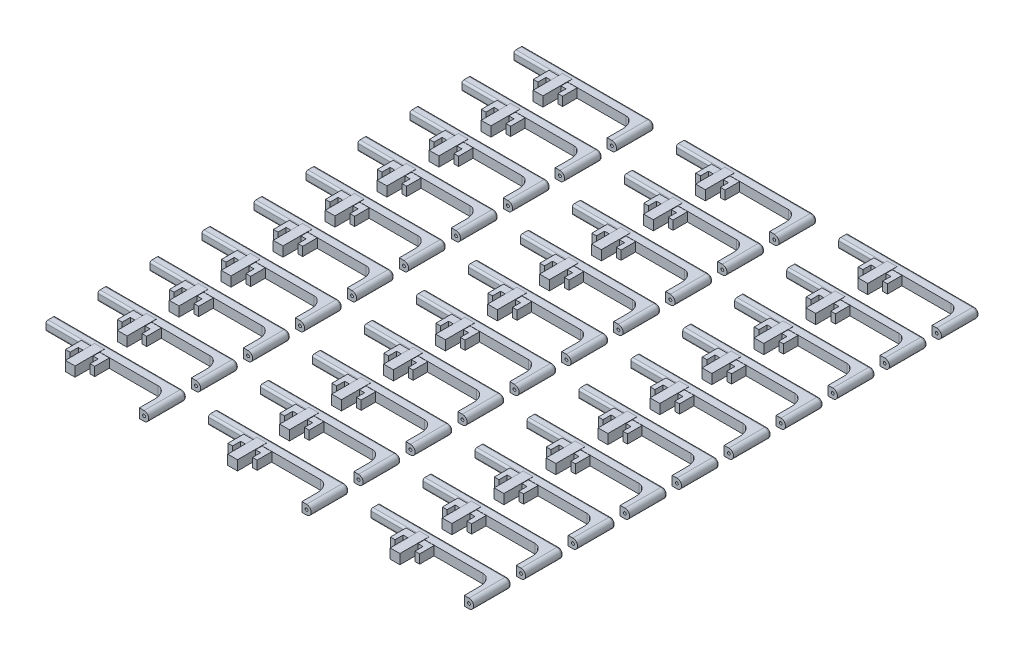
from build123d import *

# Parameters (mm, degrees)
SKETCH_1_W               = 2.4
SKETCH_1_H               = 2.4
EXTRUDE_1_DEPTH          = 7.2
EXTRUDE_2_DEPTH          = 18
EXTRUDE_2_DEPTH_BACK     = 12
SKETCH_4_W               = 2.3
SKETCH_4_H               = 2.3
EXTRUDE_3_DEPTH          = 7
EXTRUDE_3_DEPTH_BACK     = 2.3
SKETCH_5_R               = 0.35
SKETCH_6_R               = 0.35
CUT_EXTRUDE_1_DEPTH      = 10
FILLET_1_SIZE            = 2.4
FILLET_1_SIZE_2          = 3.2
FILLET_2_R               = 0.5
EXTRUDE_START            = -1.5
SKETCH_7_W               = 1.15
SKETCH_7_H               = 0.45
SKETCH_7_H_2             = 1.3
SKETCH_7_H_3             = 2.2
EXTRUDE_4_DEPTH          = 5.1
SKETCH_8_W               = 7.2
SKETCH_8_H               = 2.2
EXTRUDE_5_DEPTH          = 3.1
PATTERN_LINEAR_1_COUNT   = 10
PATTERN_LINEAR_1_PITCH   = 12.8
PATTERN_LINEAR_1_2_COUNT = 3
PATTERN_LINEAR_1_2_PITCH = 40


with BuildPart() as part:
    # 草图1 → 凸台-拉伸1 (new body)
    with BuildSketch(Plane.XY):
        Rectangle(SKETCH_1_W, SKETCH_1_H)
    extrude(amount=EXTRUDE_1_DEPTH)

    # 草图4 → 凸台-拉伸2 (add, two sides: drawn at the far end of the back side and taken through both)
    with BuildSketch(Plane(origin=(0, 0, 0), x_dir=(0, 0, -1), z_dir=(1, 0, 0)).offset(-EXTRUDE_2_DEPTH_BACK)):
        Rectangle(SKETCH_4_W, SKETCH_4_H)
    extrude(amount=EXTRUDE_2_DEPTH + EXTRUDE_2_DEPTH_BACK)

    # 草图5 → 凸台-拉伸3 (add, two sides: drawn at the far end of the back side and taken through both)
    with BuildSketch(Plane.XY.offset(1.15).offset(-EXTRUDE_3_DEPTH_BACK)):
        with BuildLine():
            Line((18, 0), (18, 1.15))
            Line((18, 1.15), (19.15, 1.15))
            ThreePointArc((19.15, 1.15), (20.3, 0), (19.15, -1.15))
            Line((19.15, -1.15), (18, -1.15))
            Line((18, -1.15), (18, 0))
        make_face()
        with Locations(Location((19.15, 0, 0), (0, 0, 180))):
            Circle(SKETCH_5_R, mode=Mode.SUBTRACT)
    extrude(amount=EXTRUDE_3_DEPTH + EXTRUDE_3_DEPTH_BACK)

    # 草图6 → 切除-拉伸1 (cut)
    with BuildSketch(Plane.ZY.offset(12)):
        Circle(SKETCH_6_R)
    extrude(amount=-CUT_EXTRUDE_1_DEPTH, mode=Mode.SUBTRACT)

    # 圆角1
    # an asymmetric fillet: 3.2, 2.4 mm, written as the material it adds along each edge
    with BuildSketch(Plane(origin=(18, 1.15, 1.15), x_dir=(-1, 0, 0), z_dir=(0, -1, 0))) as fillet_1_piece_1:
        with BuildLine():
            Bezier((FILLET_1_SIZE, 0), (0, 0), (0, -FILLET_1_SIZE_2), weights=[1, 0.707106781, 1])
            Line((0, -FILLET_1_SIZE_2), (0, 0))
            Line((0, 0), (FILLET_1_SIZE, 0))
        make_face()
    extrude(amount=2.3)

    # 圆角2
    fillet_2_edges = [part.edges().sort_by_distance(p)[0] for p in [
        (-6.6, -1.15, 1.15),
        (3.575, -1.15, -1.15),
        (-6.6, 1.15, 1.15),
        (3.575, 1.15, -1.15),
        (20.3, 0, -1.15),
    ]]
    fillet(fillet_2_edges, radius=FILLET_2_R)

    # 草图7 → 凸台-拉伸4 (add)
    with BuildSketch(Plane.XY.offset(1.15).offset(EXTRUDE_START)):
        with Locations((-3.025, 0.875)):
            Rectangle(SKETCH_7_W, SKETCH_7_H)
        with Locations((-3.025, 0)):
            Rectangle(SKETCH_7_W, SKETCH_7_H_2)
        with Locations((-3.025, -0.875)):
            Rectangle(SKETCH_7_W, SKETCH_7_H)
        with Locations((3.025, 0)):
            Rectangle(SKETCH_7_W, SKETCH_7_H_3)
    extrude(amount=EXTRUDE_4_DEPTH)

    # 草图8 → 凸台-拉伸5 (add)
    with BuildSketch(Plane.XY.offset(1.15).offset(EXTRUDE_START)):
        Rectangle(SKETCH_8_W, SKETCH_8_H)
    extrude(amount=EXTRUDE_5_DEPTH)


with BuildPart() as pattern_linear_1_1:
    # 阵列(线性)1: pattern copy
    add(part.part.moved(Location(Vector(0, 0, 1) * (1 * PATTERN_LINEAR_1_PITCH))))


with BuildPart() as pattern_linear_1_2:
    # 阵列(线性)1: pattern copy
    add(part.part.moved(Location(Vector(0, 0, 1) * (2 * PATTERN_LINEAR_1_PITCH))))


with BuildPart() as pattern_linear_1_3:
    # 阵列(线性)1: pattern copy
    add(part.part.moved(Location(Vector(0, 0, 1) * (3 * PATTERN_LINEAR_1_PITCH))))


with BuildPart() as pattern_linear_1_4:
    # 阵列(线性)1: pattern copy
    add(part.part.moved(Location(Vector(0, 0, 1) * (4 * PATTERN_LINEAR_1_PITCH))))


with BuildPart() as pattern_linear_1_5:
    # 阵列(线性)1: pattern copy
    add(part.part.moved(Location(Vector(0, 0, 1) * (5 * PATTERN_LINEAR_1_PITCH))))


with BuildPart() as pattern_linear_1_6:
    # 阵列(线性)1: pattern copy
    add(part.part.moved(Location(Vector(0, 0, 1) * (6 * PATTERN_LINEAR_1_PITCH))))


with BuildPart() as pattern_linear_1_7:
    # 阵列(线性)1: pattern copy
    add(part.part.moved(Location(Vector(0, 0, 1) * (7 * PATTERN_LINEAR_1_PITCH))))


with BuildPart() as pattern_linear_1_8:
    # 阵列(线性)1: pattern copy
    add(part.part.moved(Location(Vector(0, 0, 1) * (8 * PATTERN_LINEAR_1_PITCH))))


with BuildPart() as pattern_linear_1_9:
    # 阵列(线性)1: pattern copy
    add(part.part.moved(Location(Vector(0, 0, 1) * (9 * PATTERN_LINEAR_1_PITCH))))


with BuildPart() as pattern_linear_1_2_1:
    # Pattern Linear 1 2: pattern copy
    add(part.part.moved(Location(Vector(1, 0, 0) * (1 * PATTERN_LINEAR_1_2_PITCH))))


with BuildPart() as pattern_linear_1_2_2:
    # Pattern Linear 1 2: pattern copy
    add(part.part.moved(Location(Vector(1, 0, 0) * (2 * PATTERN_LINEAR_1_2_PITCH))))


with BuildPart() as pattern_linear_1_2_3:
    # Pattern Linear 1 2: pattern copy
    add(pattern_linear_1_1.part.moved(Location(Vector(1, 0, 0) * (1 * PATTERN_LINEAR_1_2_PITCH))))


with BuildPart() as pattern_linear_1_2_4:
    # Pattern Linear 1 2: pattern copy
    add(pattern_linear_1_1.part.moved(Location(Vector(1, 0, 0) * (2 * PATTERN_LINEAR_1_2_PITCH))))


with BuildPart() as pattern_linear_1_2_5:
    # Pattern Linear 1 2: pattern copy
    add(pattern_linear_1_2.part.moved(Location(Vector(1, 0, 0) * (1 * PATTERN_LINEAR_1_2_PITCH))))


with BuildPart() as pattern_linear_1_2_6:
    # Pattern Linear 1 2: pattern copy
    add(pattern_linear_1_2.part.moved(Location(Vector(1, 0, 0) * (2 * PATTERN_LINEAR_1_2_PITCH))))


with BuildPart() as pattern_linear_1_2_7:
    # Pattern Linear 1 2: pattern copy
    add(pattern_linear_1_3.part.moved(Location(Vector(1, 0, 0) * (1 * PATTERN_LINEAR_1_2_PITCH))))


with BuildPart() as pattern_linear_1_2_8:
    # Pattern Linear 1 2: pattern copy
    add(pattern_linear_1_3.part.moved(Location(Vector(1, 0, 0) * (2 * PATTERN_LINEAR_1_2_PITCH))))


with BuildPart() as pattern_linear_1_2_9:
    # Pattern Linear 1 2: pattern copy
    add(pattern_linear_1_4.part.moved(Location(Vector(1, 0, 0) * (1 * PATTERN_LINEAR_1_2_PITCH))))


with BuildPart() as pattern_linear_1_2_10:
    # Pattern Linear 1 2: pattern copy
    add(pattern_linear_1_4.part.moved(Location(Vector(1, 0, 0) * (2 * PATTERN_LINEAR_1_2_PITCH))))


with BuildPart() as pattern_linear_1_2_11:
    # Pattern Linear 1 2: pattern copy
    add(pattern_linear_1_5.part.moved(Location(Vector(1, 0, 0) * (1 * PATTERN_LINEAR_1_2_PITCH))))


with BuildPart() as pattern_linear_1_2_12:
    # Pattern Linear 1 2: pattern copy
    add(pattern_linear_1_5.part.moved(Location(Vector(1, 0, 0) * (2 * PATTERN_LINEAR_1_2_PITCH))))


with BuildPart() as pattern_linear_1_2_13:
    # Pattern Linear 1 2: pattern copy
    add(pattern_linear_1_6.part.moved(Location(Vector(1, 0, 0) * (1 * PATTERN_LINEAR_1_2_PITCH))))


with BuildPart() as pattern_linear_1_2_14:
    # Pattern Linear 1 2: pattern copy
    add(pattern_linear_1_6.part.moved(Location(Vector(1, 0, 0) * (2 * PATTERN_LINEAR_1_2_PITCH))))


with BuildPart() as pattern_linear_1_2_15:
    # Pattern Linear 1 2: pattern copy
    add(pattern_linear_1_7.part.moved(Location(Vector(1, 0, 0) * (1 * PATTERN_LINEAR_1_2_PITCH))))


with BuildPart() as pattern_linear_1_2_16:
    # Pattern Linear 1 2: pattern copy
    add(pattern_linear_1_7.part.moved(Location(Vector(1, 0, 0) * (2 * PATTERN_LINEAR_1_2_PITCH))))


with BuildPart() as pattern_linear_1_2_17:
    # Pattern Linear 1 2: pattern copy
    add(pattern_linear_1_8.part.moved(Location(Vector(1, 0, 0) * (1 * PATTERN_LINEAR_1_2_PITCH))))


with BuildPart() as pattern_linear_1_2_18:
    # Pattern Linear 1 2: pattern copy
    add(pattern_linear_1_8.part.moved(Location(Vector(1, 0, 0) * (2 * PATTERN_LINEAR_1_2_PITCH))))


with BuildPart() as pattern_linear_1_2_19:
    # Pattern Linear 1 2: pattern copy
    add(pattern_linear_1_9.part.moved(Location(Vector(1, 0, 0) * (1 * PATTERN_LINEAR_1_2_PITCH))))


with BuildPart() as pattern_linear_1_2_20:
    # Pattern Linear 1 2: pattern copy
    add(pattern_linear_1_9.part.moved(Location(Vector(1, 0, 0) * (2 * PATTERN_LINEAR_1_2_PITCH))))


solid = Compound([part.part, pattern_linear_1_1.part, pattern_linear_1_2.part, pattern_linear_1_3.part, pattern_linear_1_4.part, pattern_linear_1_5.part, pattern_linear_1_6.part, pattern_linear_1_7.part, pattern_linear_1_8.part, pattern_linear_1_9.part, pattern_linear_1_2_1.part, pattern_linear_1_2_2.part, pattern_linear_1_2_3.part, pattern_linear_1_2_4.part, pattern_linear_1_2_5.part, pattern_linear_1_2_6.part, pattern_linear_1_2_7.part, pattern_linear_1_2_8.part, pattern_linear_1_2_9.part, pattern_linear_1_2_10.part, pattern_linear_1_2_11.part, pattern_linear_1_2_12.part, pattern_linear_1_2_13.part, pattern_linear_1_2_14.part, pattern_linear_1_2_15.part, pattern_linear_1_2_16.part, pattern_linear_1_2_17.part, pattern_linear_1_2_18.part, pattern_linear_1_2_19.part, pattern_linear_1_2_20.part])
